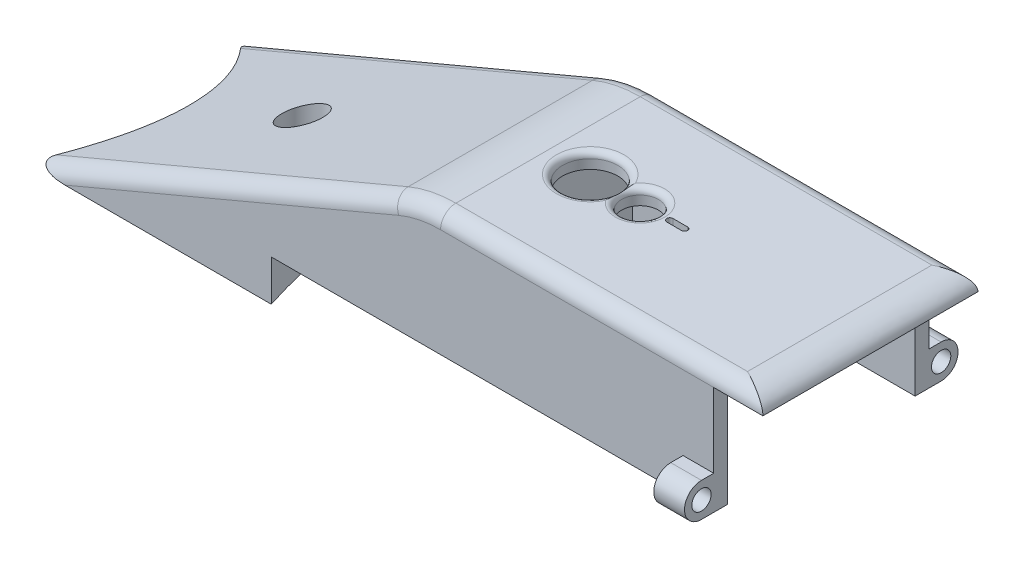
from build123d import *

# Parameters (mm, degrees)
BOSS_EXTRUDE1_DEPTH     = 22.225
FILLET1_R               = 25.4
CUT_EXTRUDE1_DEPTH      = 129.456170755
CUT_EXTRUDE1_DEPTH_BACK = 129.456170755
SKETCH2_W               = 58.42
SKETCH2_H               = 2.835975014
BOSS_EXTRUDE2_DEPTH     = 22.352
FILLET2_SIZE            = 3.175
FILLET2_SIZE_2          = 6.35
SKETCH4_R               = 5.715
SKETCH4_R_2             = 3.81
CUT_EXTRUDE2_DEPTH      = 3.175
FILLET4_R               = 1.27
SKETCH5_R               = 2.5
CUT_EXTRUDE3_DEPTH      = 110.417000644
CUT_EXTRUDE5_DEPTH      = 7
SKETCH8_R               = 2
BOSS_EXTRUDE3_DEPTH     = 6.35
FILLET3_R               = 3.175
SKETCH6_R               = 4.25
CUT_EXTRUDE8_DEPTH      = 24.13


with BuildPart() as part:
    # Sketch1 → Boss-Extrude1 (new, symmetric)
    with BuildSketch(Plane.XY):
        Polygon((-17.78, 72.220471881), (-17.78, 49.868471881), (-50.8, 49.868471881), (-50.8, 41.401805214), (-101.6, 41.401805214), (-20.955, 75.395471881), (50.8, 75.395471881), (50.8, 72.220471881), align=None)
    extrude(amount=BOSS_EXTRUDE1_DEPTH, both=True)

    # Fillet1
    fillet1_edges = [part.edges().sort_by_distance(p)[0] for p in [
        (-20.955, 75.395471881, 0),
    ]]
    fillet(fillet1_edges, radius=FILLET1_R)

    # Sketch3 → Cut-Extrude1 (cut, two sides: drawn at the far end of the back side and taken through both)
    with BuildSketch(Plane(origin=(-50.8, 0, 0), x_dir=(0, 0, -1), z_dir=(1, 0, 0)).offset(-CUT_EXTRUDE1_DEPTH_BACK)):
        with BuildLine():
            Line((-132.858425435, -9.823961327), (-22.225, 41.401805214))
            ThreePointArc((-22.225, 41.401805214), (0, 46.297479222), (22.225, 41.401805214))
            Line((22.225, 41.401805214), (132.858425435, -9.823961327))
            Line((132.858425435, -9.823961327), (132.858425435, -253.658610064))
            Line((132.858425435, -253.658610064), (-132.858425435, -253.658610064))
            Line((-132.858425435, -253.658610064), (-132.858425435, -9.823961327))
        make_face()
    extrude(amount=CUT_EXTRUDE1_DEPTH + CUT_EXTRUDE1_DEPTH_BACK, mode=Mode.SUBTRACT)

    # Sketch2 → Boss-Extrude2 (add)
    with BuildSketch(Plane.XZ.offset(-72.220471881)):
        with Locations((11.43, 20.807012493)):
            Rectangle(SKETCH2_W, SKETCH2_H)
        with Locations((11.43, -20.807012493)):
            Rectangle(SKETCH2_W, SKETCH2_H)
    extrude(amount=BOSS_EXTRUDE2_DEPTH)

    # Fillet2
    # an asymmetric fillet: 6.35, 3.175 mm, written as the material it takes off along each edge
    with BuildSketch(Plane(origin=(50.8, 75.395471881, -38.1), x_dir=(0, -1, 0), z_dir=(0, 0, 1))) as fillet2_piece_1:
        with BuildLine():
            Bezier((FILLET2_SIZE, 0), (0, 0), (0, -FILLET2_SIZE_2), weights=[1, 0.707106781, 1])
            Line((0, -FILLET2_SIZE_2), (0, 0))
            Line((0, 0), (FILLET2_SIZE, 0))
        make_face()
    extrude(amount=76.2, mode=Mode.SUBTRACT)

    # Sketch4 → Cut-Extrude2 (cut)
    with BuildSketch(Plane(origin=(0, 75.395471881, 0), x_dir=(1, 0, 0), z_dir=(0, 1, 0))):
        with Locations(Location((-7.110857048, 0, 0), (0, 0, 270))):
            Circle(SKETCH4_R)
        with Locations(Location((3.189142952, 0, 0), (0, 0, 270))):
            Circle(SKETCH4_R_2)
        with BuildLine():
            Line((9.34361728, 0.635), (12.39161728, 0.635))
            ThreePointArc((12.39161728, 0.635), (13.02661728, 0), (12.39161728, -0.635))
            Line((12.39161728, -0.635), (9.34361728, -0.635))
            ThreePointArc((9.34361728, -0.635), (8.70861728, 0), (9.34361728, 0.635))
        make_face()
    extrude(amount=-CUT_EXTRUDE2_DEPTH, mode=Mode.SUBTRACT)

    # Fillet4
    # the kernel refuses this fillet: 1.27 mm, written as the material it takes off along each edge
    with BuildSketch(Plane(origin=(-7.110857048, 75.395471881, 0), x_dir=(0, 0, 1), z_dir=(-1, 0, 0))) as fillet4_piece_1:
        with BuildLine():
            CenterArc((5.715 + FILLET4_R, -FILLET4_R), FILLET4_R, 90, 90)
            Line((5.715, -FILLET4_R), (5.715, 0))
            Line((5.715, 0), (5.715 + FILLET4_R, 0))
        make_face()
    revolve(axis=Axis((-7.110857048, 75.395471881, 0), (0, 1, 0)), mode=Mode.SUBTRACT)
    with BuildSketch(Plane(origin=(3.189142952, 75.395471881, 0), x_dir=(0, 0, 1), z_dir=(-1, 0, 0))) as fillet4_piece_2:
        with BuildLine():
            CenterArc((3.81 + FILLET4_R, -FILLET4_R), FILLET4_R, 90, 90)
            Line((3.81, -FILLET4_R), (3.81, 0))
            Line((3.81, 0), (3.81 + FILLET4_R, 0))
        make_face()
    revolve(axis=Axis((3.189142952, 75.395471881, 0), (0, 1, 0)), mode=Mode.SUBTRACT)

    # Sketch5 → Cut-Extrude3 (cut, through all)
    with BuildSketch(Plane(origin=(0, 75.395471881, 0), x_dir=(1, 0, 0), z_dir=(0, 1, 0))):
        with Locations(Location((-66.620425581, 0, 0), (0, 0, 270))):
            Circle(SKETCH5_R)
    extrude(amount=-CUT_EXTRUDE3_DEPTH, mode=Mode.SUBTRACT)

    # Sketch7 → Cut-Extrude5 (cut)
    with BuildSketch(Plane.XZ.offset(-49.868471881)):
        with BuildLine():
            Line((-38.862, 5), (-26.162, 5))
            ThreePointArc((-26.162, 5), (-21.162, 0), (-26.162, -5))
            Line((-26.162, -5), (-38.862, -5))
            ThreePointArc((-38.862, -5), (-43.862, 0), (-38.862, 5))
        make_face()
    extrude(amount=-CUT_EXTRUDE5_DEPTH, mode=Mode.SUBTRACT)

    # Sketch8 → Boss-Extrude3 (add)
    # profile 1 of 2: a face of its own
    with BuildSketch(Plane(origin=(40.64, 0, 0), x_dir=(0, 0, -1), z_dir=(1, 0, 0))):
        with BuildLine():
            Line((-22.225, 49.868471881), (-24.765, 49.868471881))
            ThreePointArc((-24.765, 49.868471881), (-28.265, 53.368471881), (-24.765, 56.868471881))
            Line((-24.765, 56.868471881), (-22.225, 56.868471881))
            Line((-22.225, 56.868471881), (-22.225, 49.868471881))
        make_face()
        with Locations(Location((-24.765, 53.368471881, 0), (0, 0, 90))):
            Circle(SKETCH8_R, mode=Mode.SUBTRACT)
    # profile 2 of 2: a face of its own
    with BuildSketch(Plane(origin=(40.64, 0, 0), x_dir=(0, 0, -1), z_dir=(1, 0, 0))):
        with BuildLine():
            Line((22.225, 56.868471881), (22.225, 49.868471881))
            Line((22.225, 49.868471881), (24.765, 49.868471881))
            ThreePointArc((24.765, 49.868471881), (28.265, 53.368471881), (24.765, 56.868471881))
            Line((24.765, 56.868471881), (22.225, 56.868471881))
        make_face()
        with Locations(Location((24.765, 53.368471881, 0), (0, 0, 270))):
            Circle(SKETCH8_R, mode=Mode.SUBTRACT)
    extrude(amount=-BOSS_EXTRUDE3_DEPTH)

    # Fillet3
    # the kernel refuses this fillet: 3.175 mm, written as the material it takes off along each edge
    with BuildSketch(Plane(origin=(-15.820425581, 75.395471881, -22.225), x_dir=(0, -1, 0), z_dir=(1, 0, 0))) as fillet3_piece_1:
        with BuildLine():
            CenterArc((FILLET3_R, -FILLET3_R), FILLET3_R, 90, 90)
            Line((0, -FILLET3_R), (0, 0))
            Line((0, 0), (FILLET3_R, 0))
        make_face()
    extrude(amount=68.207925581, mode=Mode.SUBTRACT)
    with BuildSketch(Plane(origin=(-15.820425581, 49.995471881, -22.225), x_dir=(0, 1, 0), z_dir=(1, 0, 0))) as fillet3_piece_2:
        with BuildLine():
            CenterArc((25.4 - FILLET3_R, FILLET3_R), FILLET3_R, 270, 90)
            Line((25.4 - FILLET3_R, 0), (25.4, 0))
            Line((25.4, 0), (25.4, FILLET3_R))
        make_face()
    revolve(axis=Axis((-15.820425581, 49.995471881, -22.225), (0, 0, 1)), revolution_arc=22.856508496, mode=Mode.SUBTRACT)
    with BuildSketch(Plane(origin=(-108.914251568, 38.318685, -22.225), x_dir=(0.38842459395806633, -0.921480512440991, 0), z_dir=(0.921480512440991, 0.38842459395806633, 0))) as fillet3_piece_3:
        with BuildLine():
            CenterArc((FILLET3_R, -FILLET3_R), FILLET3_R, 90, 90)
            Line((0, -FILLET3_R), (0, 0))
            Line((0, 0), (FILLET3_R, 0))
        make_face()
    extrude(amount=90.319697679, mode=Mode.SUBTRACT)
    with BuildSketch(Plane(origin=(-108.914251568, 38.318685, 22.225), x_dir=(0.38842459395806633, -0.921480512440991, 0), z_dir=(0.921480512440991, 0.38842459395806633, 0))) as fillet3_piece_4:
        with BuildLine():
            CenterArc((FILLET3_R, FILLET3_R), FILLET3_R, 180, 90)
            Line((0, FILLET3_R), (0, 0))
            Line((0, 0), (FILLET3_R, 0))
        make_face()
    extrude(amount=90.319697679, mode=Mode.SUBTRACT)
    with BuildSketch(Plane(origin=(-15.820425581, 49.995471881, 22.225), x_dir=(0, 1, 0), z_dir=(1, 0, 0))) as fillet3_piece_5:
        with BuildLine():
            CenterArc((25.4 - FILLET3_R, -FILLET3_R), FILLET3_R, 0, 90)
            Line((25.4, -FILLET3_R), (25.4, 0))
            Line((25.4, 0), (25.4 - FILLET3_R, 0))
        make_face()
    revolve(axis=Axis((-15.820425581, 49.995471881, 22.225), (0, 0, 1)), revolution_arc=22.856508496, mode=Mode.SUBTRACT)
    with BuildSketch(Plane(origin=(-15.820425581, 75.395471881, 22.225), x_dir=(0, -1, 0), z_dir=(1, 0, 0))) as fillet3_piece_6:
        with BuildLine():
            CenterArc((FILLET3_R, FILLET3_R), FILLET3_R, 180, 90)
            Line((0, FILLET3_R), (0, 0))
            Line((0, 0), (FILLET3_R, 0))
        make_face()
    extrude(amount=68.207925581, mode=Mode.SUBTRACT)

    # Sketch6 → Cut-Extrude8 (cut)
    with BuildSketch(Plane(origin=(0, 75.395471881, 0), x_dir=(1, 0, 0), z_dir=(0, 1, 0))):
        with Locations(Location((-66.620425581, 0, 0), (0, 0, 270))):
            Circle(SKETCH6_R)
    extrude(amount=-CUT_EXTRUDE8_DEPTH, mode=Mode.SUBTRACT)


solid = part.part
